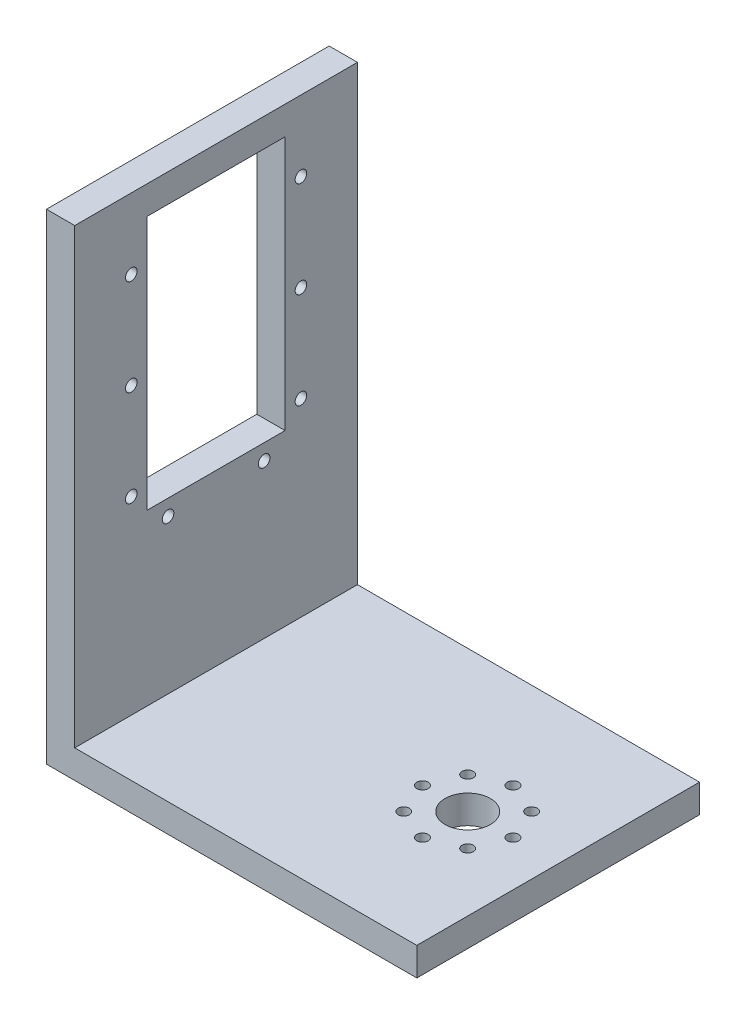
from build123d import *

# Parameters (mm, degrees)
SKETCH1_W           = 65.5
SKETCH1_H           = 50
SKETCH1_R           = 4
SKETCH1_R_2         = 1
BOSS_EXTRUDE1_DEPTH = 5
SKETCH3_W           = 5
SKETCH3_H           = 50
BOSS_EXTRUDE2_DEPTH = 85
SKETCH4_R           = 1.025
SKETCH4_W           = 24.4
SKETCH4_H           = 45
CUT_EXTRUDE1_DEPTH  = 119.386021134


with BuildPart() as part:
    # Sketch1 → Boss-Extrude1 (new body)
    with BuildSketch(Plane(origin=(0, 0, 0), x_dir=(1, 0, 0), z_dir=(0, 1, 0))):
        with Locations((32.75, 25)):
            Rectangle(SKETCH1_W, SKETCH1_H)
        with Locations((49.5, 25)):
            Circle(SKETCH1_R, mode=Mode.SUBTRACT)
        with Locations((49.5, 33)):
            Circle(SKETCH1_R_2, mode=Mode.SUBTRACT)
        with Locations((55.156854249, 30.656854249)):
            Circle(SKETCH1_R_2, mode=Mode.SUBTRACT)
        with Locations((57.5, 25)):
            Circle(SKETCH1_R_2, mode=Mode.SUBTRACT)
        with Locations((55.156854249, 19.343145751)):
            Circle(SKETCH1_R_2, mode=Mode.SUBTRACT)
        with Locations((49.5, 17)):
            Circle(SKETCH1_R_2, mode=Mode.SUBTRACT)
        with Locations((43.843145751, 19.343145751)):
            Circle(SKETCH1_R_2, mode=Mode.SUBTRACT)
        with Locations((41.5, 25)):
            Circle(SKETCH1_R_2, mode=Mode.SUBTRACT)
        with Locations((43.843145751, 30.656854249)):
            Circle(SKETCH1_R_2, mode=Mode.SUBTRACT)
    extrude(amount=BOSS_EXTRUDE1_DEPTH)

    # Sketch3 → Boss-Extrude2 (add)
    with BuildSketch(Plane(origin=(0, 0, 0), x_dir=(1, 0, 0), z_dir=(0, 1, 0))):
        with Locations((2.5, 25)):
            Rectangle(SKETCH3_W, SKETCH3_H)
    extrude(amount=BOSS_EXTRUDE2_DEPTH)

    # Sketch4 → Cut-Extrude1 (cut, through all)
    with BuildSketch(Plane.ZY):
        with Locations((-40, 72.5)):
            Circle(SKETCH4_R)
        with Locations((-10, 72.5)):
            Circle(SKETCH4_R)
        with Locations((-40, 55.5)):
            Circle(SKETCH4_R)
        with Locations((-40, 38.5)):
            Circle(SKETCH4_R)
        with Locations((-10, 55.5)):
            Circle(SKETCH4_R)
        with Locations((-33.5, 32.2)):
            Circle(SKETCH4_R)
        with Locations((-16.5, 32.2)):
            Circle(SKETCH4_R)
        with Locations((-10, 38.5)):
            Circle(SKETCH4_R)
        with Locations((-25, 57.5)):
            Rectangle(SKETCH4_W, SKETCH4_H)
    extrude(amount=-CUT_EXTRUDE1_DEPTH, mode=Mode.SUBTRACT)


solid = part.part
